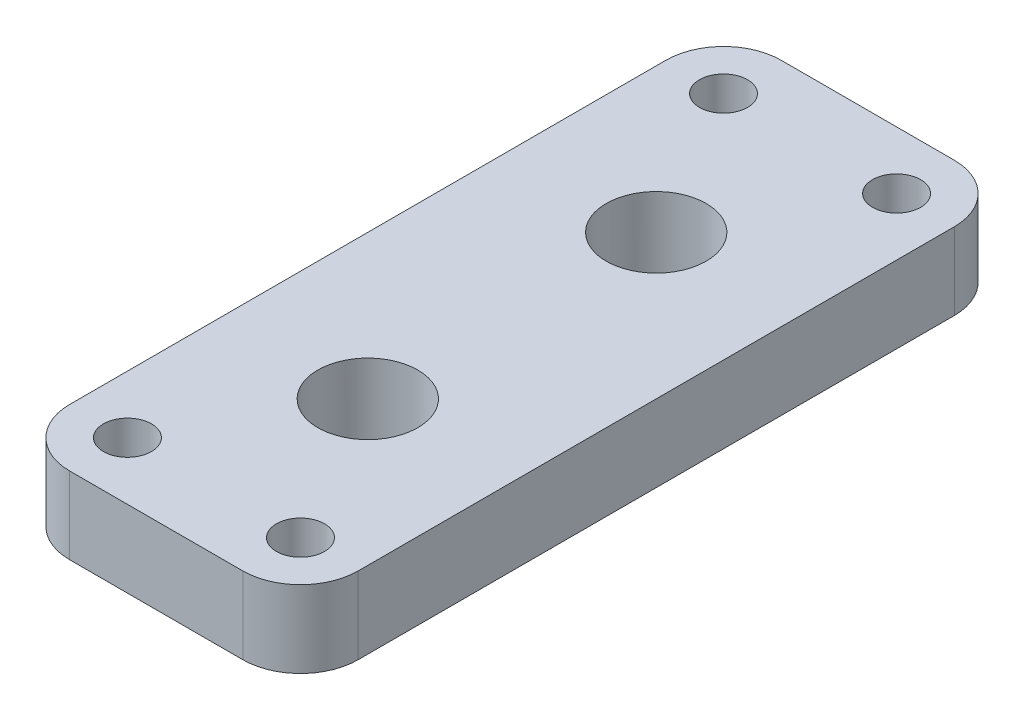
from build123d import *

# Parameters (mm, degrees)
SKETCH_1_W          = 65
SKETCH_1_H          = 25
EXTRUDE_1_DEPTH     = 4
SKETCH_2_W          = 15
SKETCH_2_H          = 25
EXTRUDE_2_DEPTH     = 13
SKETCH_3_R          = 2.6
SKETCH_3_R_2        = 4.1
CUT_EXTRUDE_1_DEPTH = 39.74919354
SKETCH_5_W          = 15
SKETCH_5_H          = 4
EXTRUDE_3_DEPTH     = 6
SKETCH_6_R          = 1.25
CUT_EXTRUDE_3_DEPTH = 40.59166579
FILLET_2_R          = 3
CUT_EXTRUDE_4_DEPTH = 49.023431781
SKETCH_8_W          = 15
SKETCH_8_H          = 9
CUT_EXTRUDE_5_DEPTH = 37.142080737


with BuildPart() as part:
    # 草图1 → 凸台-拉伸1 (new body)
    with BuildSketch(Plane(origin=(0, 0, 0), x_dir=(1, 0, 0), z_dir=(0, 1, 0))):
        Rectangle(SKETCH_1_W, SKETCH_1_H)
    extrude(amount=EXTRUDE_1_DEPTH)

    # 草图2 → 凸台-拉伸2 (add)
    with BuildSketch(Plane(origin=(0, 4, 0), x_dir=(1, 0, 0), z_dir=(0, 1, 0))):
        Rectangle(SKETCH_2_W, SKETCH_2_H)
    extrude(amount=EXTRUDE_2_DEPTH)

    # 草图3 → 切除-拉伸1 (cut, through all)
    with BuildSketch(Plane.XZ):
        with Locations((0, -7.5)):
            Circle(SKETCH_3_R)
        with Locations((0, 7.5)):
            Circle(SKETCH_3_R)
        with Locations((-22, 0)):
            Circle(SKETCH_3_R_2)
        with Locations((22, 0)):
            Circle(SKETCH_3_R_2)
    extrude(amount=-CUT_EXTRUDE_1_DEPTH, mode=Mode.SUBTRACT)

    # 草图5 → 凸台-拉伸3 (add)
    with BuildSketch(Plane.XY.offset(12.5)):
        with Locations((0, 6)):
            Rectangle(SKETCH_5_W, SKETCH_5_H)
    extrude_3 = extrude(amount=EXTRUDE_3_DEPTH)

    # 草图6 → 切除-拉伸3 (cut, through all)
    with BuildSketch(Plane.XZ.offset(-4)):
        with Locations((-4.5, 15.5)):
            Circle(SKETCH_6_R)
        with Locations((4.5, 15.5)):
            Circle(SKETCH_6_R)
    cut_extrude_3 = extrude(amount=-CUT_EXTRUDE_3_DEPTH, mode=Mode.SUBTRACT)

    # 镜向2: 凸台-拉伸3, 切除-拉伸3 across plane
    add(extrude_3.mirror(Plane.XY))
    add(cut_extrude_3.mirror(Plane.XY), mode=Mode.SUBTRACT)

    # 圆角2
    fillet_2_edges = [part.edges().sort_by_distance(p)[0] for p in [
        (-7.5, 6, -18.5),
        (7.5, 6, -18.5),
        (-7.5, 6, 18.5),
        (7.5, 6, 18.5),
    ]]
    fillet(fillet_2_edges, radius=FILLET_2_R)

    # 草图7 → 切除-拉伸4 (cut, through all)
    with BuildSketch(Plane(origin=(0, 0, -12.5), x_dir=(-1, 0, 0), z_dir=(0, 0, -1))):
        Polygon((32.5, 4), (7.5, 4), (-7.5, 4), (-32.5, 4), (-32.5, 0), (32.5, 0), align=None)
    extrude(amount=-CUT_EXTRUDE_4_DEPTH, mode=Mode.SUBTRACT)

    # 草图8 → 切除-拉伸5 (cut, through all)
    with BuildSketch(Plane.XY.offset(12.5)):
        with Locations((0, 12.5)):
            Rectangle(SKETCH_8_W, SKETCH_8_H)
    extrude(amount=-CUT_EXTRUDE_5_DEPTH, mode=Mode.SUBTRACT)


solid = part.part
